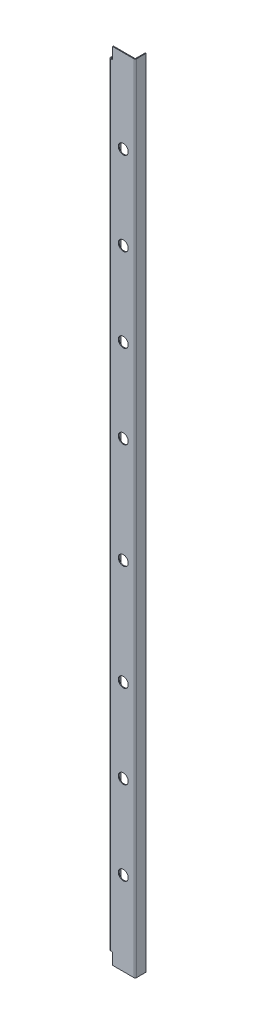
from build123d import *

# Parameters (mm, degrees)
BASE_FLANGE1_DEPTH      = 1200
SKETCH6_W               = 5
SKETCH6_H               = 17
CUT_EXTRUDE1_DEPTH      = 10
SKETCH7_W               = 5
SKETCH7_H               = 17.5
CUT_EXTRUDE2_DEPTH      = 1201.707645516
CUT_EXTRUDE3_DEPTH      = 1201.707645516
CUT_EXTRUDE3_DEPTH_BACK = 1201.707645516
SKETCH8_R               = 7.5


# Sheet-metal steps are written as plain solids
with BuildPart() as part:
    # Sketch1 → Base-Flange1 (new body)
    with BuildSketch(Plane(origin=(0, 0, 0), x_dir=(1, 0, 0), z_dir=(0, 1, 0))):
        with BuildLine():
            Line((36.7, 15), (36.7, 0.7))
            ThreePointArc((36.7, 0.7), (36.494974747, 0.205025253), (36, 0))
            Line((36, 0), (0.7, 0))
            ThreePointArc((0.7, 0), (0.205025253, 0.205025253), (0, 0.7))
            Line((0, 0.7), (0, 15))
            Line((0, 15), (-1.2, 15))
            Line((-1.2, 15), (-1.2, 0.7))
            ThreePointArc((-1.2, 0.7), (-0.643502884, -0.643502884), (0.7, -1.2))
            Line((0.7, -1.2), (36, -1.2))
            ThreePointArc((36, -1.2), (37.343502884, -0.643502884), (37.9, 0.7))
            Line((37.9, 0.7), (37.9, 15))
            Line((37.9, 15), (36.7, 15))
        make_face()
    extrude(amount=BASE_FLANGE1_DEPTH)

    # Sketch6 → Cut-Extrude1 (cut)
    with BuildSketch(Plane.ZY.offset(1.2)):
        with Locations((-12.5, 1191.5)):
            Rectangle(SKETCH6_W, SKETCH6_H)
        with Locations((-12.5, 8.5)):
            Rectangle(SKETCH6_W, SKETCH6_H)
    extrude(amount=-CUT_EXTRUDE1_DEPTH, mode=Mode.SUBTRACT)

    # Sketch7 → Cut-Extrude2 (cut, through all)
    with BuildSketch(Plane.XY.offset(1.2)):
        with Locations((1.3, 8.75)):
            Rectangle(SKETCH7_W, SKETCH7_H)
        with Locations((1.3, 1191.25)):
            Rectangle(SKETCH7_W, SKETCH7_H)
    extrude(amount=-CUT_EXTRUDE2_DEPTH, mode=Mode.SUBTRACT)

    # Sketch8 → Cut-Extrude3 (cut, two sides: drawn at the far end of the back side and taken through both)
    with BuildSketch(Plane.XY.offset(1.2).offset(-CUT_EXTRUDE3_DEPTH_BACK)):
        with Locations(Location((19.9, 126, 0), (0, 0, 180))):
            Circle(SKETCH8_R)
        with Locations(Location((19.9, 252, 0), (0, 0, 180))):
            Circle(SKETCH8_R)
        with Locations(Location((19.9, 378, 0), (0, 0, 180))):
            Circle(SKETCH8_R)
        with Locations(Location((19.9, 1074, 0), (0, 0, 180))):
            Circle(SKETCH8_R)
        with Locations(Location((19.9, 948, 0), (0, 0, 180))):
            Circle(SKETCH8_R)
        with Locations(Location((19.9, 822, 0), (0, 0, 180))):
            Circle(SKETCH8_R)
        with Locations(Location((19.9, 696, 0), (0, 0, 180))):
            Circle(SKETCH8_R)
        with Locations(Location((19.9, 537, 0), (0, 0, 180))):
            Circle(SKETCH8_R)
    extrude(amount=CUT_EXTRUDE3_DEPTH + CUT_EXTRUDE3_DEPTH_BACK, mode=Mode.SUBTRACT)


solid = part.part
